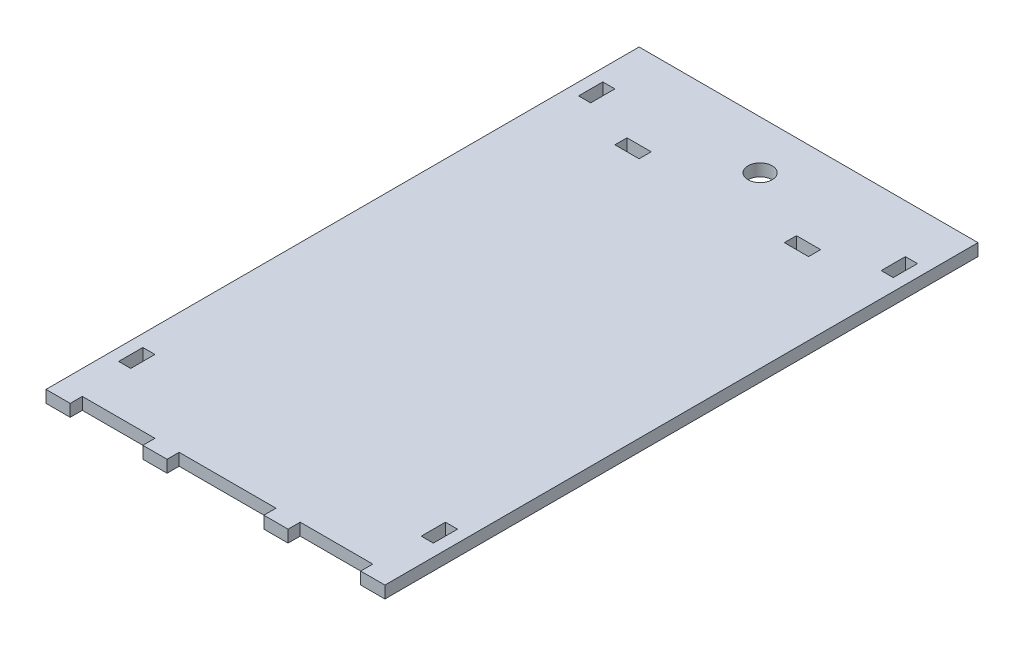
from build123d import *

# Parameters (mm, degrees)
SKETCH1_W           = 6.35
SKETCH1_H           = 12.7
SKETCH1_W_2         = 12.7
SKETCH1_H_2         = 6.35
SKETCH1_R           = 6.35
BOSS_EXTRUDE1_DEPTH = 6.35


with BuildPart() as part:
    # Sketch1 → Boss-Extrude1 (new body)
    with BuildSketch(Plane(origin=(0, 0, 0), x_dir=(1, 0, 0), z_dir=(0, 1, 0))):
        Polygon((0, 304.8), (0, -6.35), (12.7, -6.35), (12.7, 0), (50.8, 0), (50.8, -6.35), (63.5, -6.35), (63.5, 0), (114.3, 0), (114.3, -6.35), (127, -6.35), (127, 0), (165.1, 0), (165.1, -6.35), (177.8, -6.35), (177.8, 304.8), align=None)
        with Locations((9.525, 31.75)):
            Rectangle(SKETCH1_W, SKETCH1_H, mode=Mode.SUBTRACT)
        with Locations((168.275, 31.75)):
            Rectangle(SKETCH1_W, SKETCH1_H, mode=Mode.SUBTRACT)
        with Locations((44.45, 257.175)):
            Rectangle(SKETCH1_W_2, SKETCH1_H_2, mode=Mode.SUBTRACT)
        with Locations((9.525, 273.05)):
            Rectangle(SKETCH1_W, SKETCH1_H, mode=Mode.SUBTRACT)
        with Locations((133.35, 257.175)):
            Rectangle(SKETCH1_W_2, SKETCH1_H_2, mode=Mode.SUBTRACT)
        with Locations((88.9, 279.4)):
            Circle(SKETCH1_R, mode=Mode.SUBTRACT)
        with Locations((168.275, 273.05)):
            Rectangle(SKETCH1_W, SKETCH1_H, mode=Mode.SUBTRACT)
    extrude(amount=BOSS_EXTRUDE1_DEPTH)


solid = part.part
